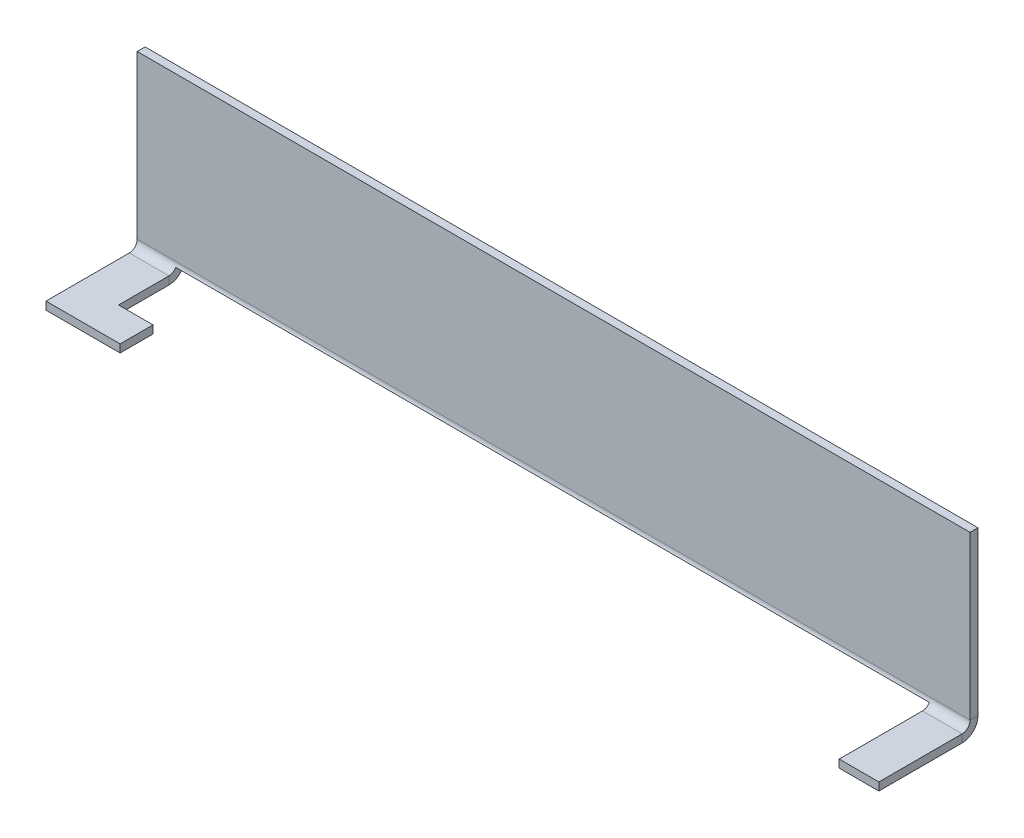
from build123d import *

# Parameters (mm, degrees)
SKETCH1_W                        = 210
SKETCH1_H                        = 45
BASE_FLANGE1_DEPTH               = 2
SM_EDGE_FLANGE_1_STRIP_W         = 12
SM_EDGE_FLANGE_1_STRIP_H         = 2
SM_EDGE_FLANGE_1_STRIP_CUT_DEPTH = 210
SM_EDGE_FLANGE_1_DEPTH           = 210
CUT_EXTRUDE1_START               = -86.312353883
CUT_EXTRUDE1_DEPTH               = 181.312353883
CUT_EXTRUDE1_START_2             = -95
CUT_EXTRUDE1_2_DEPTH             = 8.687646117


# Read off the part's stored shape, not the designer's step: Cut-Extrude1
# Sheet-metal steps are written as plain solids
with BuildPart() as part:
    # Sketch1 → Base-Flange1 (new body)
    with BuildSketch(Plane.XY):
        Rectangle(SKETCH1_W, SKETCH1_H)
    extrude(amount=-BASE_FLANGE1_DEPTH)

    # Ребро-кромка1 strip (across the edge) → Ребро-кромка1 strip cut (cut)
    with BuildSketch(Plane(origin=(-105, -22.5, 0), x_dir=(0, 1, 0), z_dir=(1, 0, 0))):
        with Locations((-2, -1)):
            Rectangle(SM_EDGE_FLANGE_1_STRIP_W, SM_EDGE_FLANGE_1_STRIP_H)
    extrude(amount=SM_EDGE_FLANGE_1_STRIP_CUT_DEPTH, mode=Mode.SUBTRACT)

    # Ребро-кромка1 section (across the edge) → Ребро-кромка1 (add)
    with BuildSketch(Plane(origin=(-105, -22.5, 0), x_dir=(0, 1, 0), z_dir=(1, 0, 0))):
        with BuildLine():
            Line((0, 2), (0, 23))
            Line((0, 23), (2, 23))
            Line((2, 23), (2, 2))
            ThreePointArc((2, 2), (2.585786438, 0.585786438), (4, 0))
            Line((4, 0), (4, -2))
            ThreePointArc((4, -2), (1.171572875, -0.828427125), (0, 2))
        make_face()
    extrude(amount=SM_EDGE_FLANGE_1_DEPTH)

    # Cut-Extrude1 outline → Cut-Extrude1 (cut)
    with BuildSketch(Plane.YZ.offset(CUT_EXTRUDE1_START)):
        with BuildLine():
            Line((-20.5, 2), (-20.5, 23))
            Line((-20.5, 23), (-22.5, 23))
            Line((-22.5, 23), (-22.5, 2))
            ThreePointArc((-22.5, 2), (-21.964101615, 0), (-20.5, -1.464101615))
            Line((-20.5, -1.464101615), (-19.5, 0.267949193))
            ThreePointArc((-19.5, 0.267949193), (-20.232050807, 1), (-20.5, 2))
        make_face()
    extrude(amount=CUT_EXTRUDE1_DEPTH, mode=Mode.SUBTRACT)

    # Cut-Extrude1 2 outline → Cut-Extrude1 2 (cut)
    with BuildSketch(Plane.YZ.offset(CUT_EXTRUDE1_START_2)):
        with BuildLine():
            Line((-20.5, 2), (-20.5, 14.70719641))
            Line((-20.5, 14.70719641), (-22.5, 14.70719641))
            Line((-22.5, 14.70719641), (-22.5, 2))
            ThreePointArc((-22.5, 2), (-21.964101615, 0), (-20.5, -1.464101615))
            Line((-20.5, -1.464101615), (-19.5, 0.267949193))
            ThreePointArc((-19.5, 0.267949193), (-20.232050807, 1), (-20.5, 2))
        make_face()
    extrude(amount=CUT_EXTRUDE1_2_DEPTH, mode=Mode.SUBTRACT)


solid = part.part
